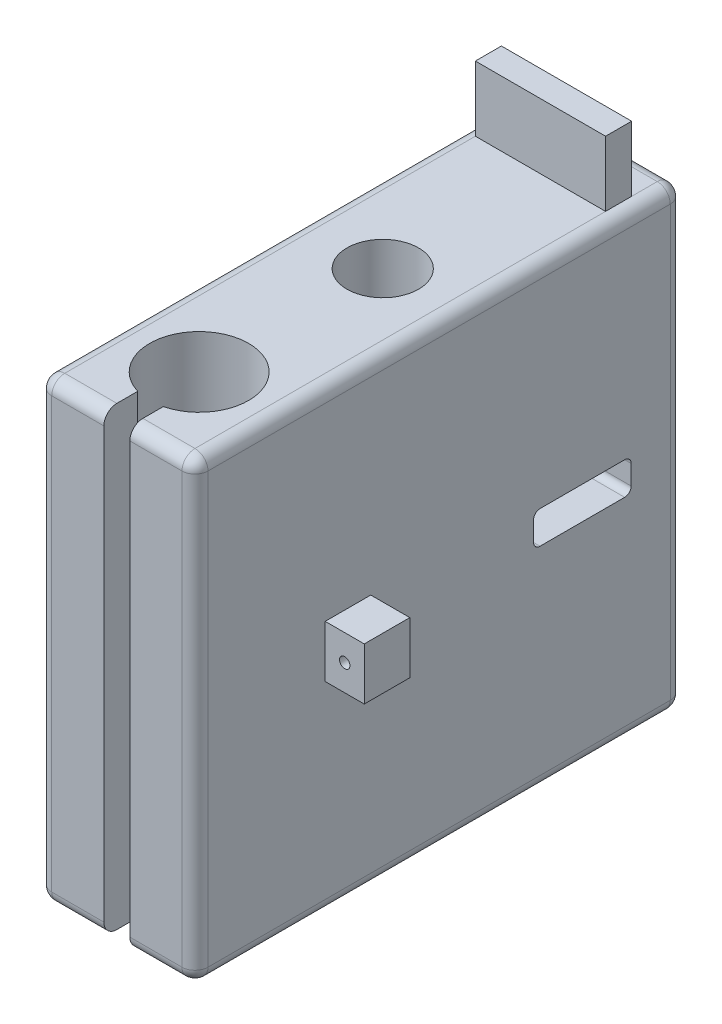
from build123d import *

# Parameters (mm, degrees)
RESSALTO_EXTRUS_O1_DEPTH                   = 12
RESSALTO_EXTRUS_O1_DEPTH_BACK              = 12
ESBO_O1_W                                  = 75
ESBO_O1_H                                  = 70
ESBO_O3_R                                  = 5.5
CORTE_EXTRUS_O1_DEPTH                      = 525.799189678
ESBO_O4_R                                  = 4.1
CORTE_EXTRUS_O2_DEPTH                      = 20
FILETE1_R                                  = 2
CORTE_EXTRUS_O3_DEPTH                      = 29
CORTE_EXTRUS_O4_DEPTH                      = 28
RESSALTO_EXTRUS_O2_DEPTH                   = 6
RESSALTO_EXTRUS_O2_DEPTH_BACK              = 30
ESBO_O7_W                                  = 7
ESBO_O7_H                                  = 8
BROCA_DE_ROSQUEAR_PARA_TARRAXA_DE_M2X0_4_D = 1.6
BROCA_DE_ROSQUEAR_PARA_TARRAXA_DE_M2_2_D   = 1.6
ESBO_O18_W                                 = 20
ESBO_O18_H                                 = 4
RESSALTO_EXTRUS_O3_DEPTH                   = 10


with BuildPart() as part:
    # Esboço1 → Ressalto-extrusão1 (new, two sides: drawn at the far end of the back side and taken through both)
    with BuildSketch(Plane(origin=(-220, 0, 0), x_dir=(0, 0, -1), z_dir=(1, 0, 0)).offset(-RESSALTO_EXTRUS_O1_DEPTH_BACK)):
        with Locations((-427.999935002, 213.253952806)):
            Rectangle(ESBO_O1_W, ESBO_O1_H)
    extrude(amount=RESSALTO_EXTRUS_O1_DEPTH + RESSALTO_EXTRUS_O1_DEPTH_BACK)

    # Esboço3 → Corte-extrusão1 (cut, through all)
    with BuildSketch(Plane(origin=(0, 248.253952806, 0), x_dir=(1, 0, 0), z_dir=(0, 1, 0))):
        with Locations((-219.508549322, -425.149935105)):
            Circle(ESBO_O3_R)
        with BuildLine():
            Line((-220, -465.499935002), (-218, -465.499935002))
            Line((-218, -465.499935002), (-218, -460.369179456))
            ThreePointArc((-218, -460.369179456), (-219.711945476, -445.401349285), (-222, -460.292000844))
            Line((-222, -460.292000844), (-222, -465.499935002))
            Line((-222, -465.499935002), (-220, -465.499935002))
        make_face()
    extrude(amount=-CORTE_EXTRUS_O1_DEPTH, mode=Mode.SUBTRACT)

    # Esboço4 → Corte-extrusão2 (cut)
    with BuildSketch(Plane(origin=(0, 0, 390.499935002), x_dir=(-1, 0, 0), z_dir=(0, 0, -1))):
        with Locations((219.858557552, 238.253952806)):
            Circle(ESBO_O4_R)
        with Locations((219.858557552, 188.253952806)):
            Circle(ESBO_O4_R)
    extrude(amount=-CORTE_EXTRUS_O2_DEPTH, mode=Mode.SUBTRACT)

    # Filete1
    filete1_edges = [part.edges().sort_by_distance(p)[0] for p in [
        (-227, 178.253952806, 465.499935002),
        (-213, 178.253952806, 465.499935002),
        (-213, 248.253952806, 465.499935002),
        (-227, 248.253952806, 465.499935002),
        (-208, 178.253952806, 427.999935002),
        (-208, 248.253952806, 427.999935002),
        (-208, 213.253952806, 465.499935002),
        (-232, 178.253952806, 427.999935002),
        (-232, 213.253952806, 465.499935002),
        (-232, 248.253952806, 427.999935002),
        (-220, 248.253952806, 390.499935002),
        (-220, 178.253952806, 390.499935002),
        (-208, 213.253952806, 390.499935002),
        (-232, 213.253952806, 390.499935002),
    ]]
    fillet(filete1_edges, radius=FILETE1_R)

    # Esboço5 → Corte-extrusão3 (cut)
    with BuildSketch(Plane(origin=(0, 0, 390.499935002), x_dir=(-1, 0, 0), z_dir=(0, 0, -1))):
        Polygon((214.016351673, 195.258511774), (226.016347643, 195.248677568), (226.045850263, 231.248665479), (214.045854293, 231.258499685), align=None)
    extrude(amount=-CORTE_EXTRUS_O3_DEPTH, mode=Mode.SUBTRACT)

    # Esboço6 → Corte-extrusão4 (cut)
    with BuildSketch(Plane.ZY.offset(232)):
        with BuildLine():
            Line((399.499935002, 215.753952806), (412.499935002, 215.753952806))
            ThreePointArc((412.499935002, 215.753952806), (413.207041783, 215.461059587), (413.499935002, 214.753952806))
            Line((413.499935002, 214.753952806), (413.499935002, 211.753952806))
            ThreePointArc((413.499935002, 211.753952806), (413.207041783, 211.046846025), (412.499935002, 210.753952806))
            Line((412.499935002, 210.753952806), (399.499935002, 210.753952806))
            ThreePointArc((399.499935002, 210.753952806), (398.792828221, 211.046846025), (398.499935002, 211.753952806))
            Line((398.499935002, 211.753952806), (398.499935002, 214.753952806))
            ThreePointArc((398.499935002, 214.753952806), (398.792828221, 215.461059587), (399.499935002, 215.753952806))
        make_face()
    extrude(amount=-CORTE_EXTRUS_O4_DEPTH, mode=Mode.SUBTRACT)

    # Esboço7 → Ressalto-extrusão2 (add, two sides: drawn at the far end of the back side and taken through both)
    with BuildSketch(Plane(origin=(-208, 0, 0), x_dir=(0, 0, -1), z_dir=(1, 0, 0)).offset(-RESSALTO_EXTRUS_O2_DEPTH_BACK)):
        with Locations((-441.999935002, 213.253952806)):
            Rectangle(ESBO_O7_W, ESBO_O7_H)
    extrude(amount=RESSALTO_EXTRUS_O2_DEPTH + RESSALTO_EXTRUS_O2_DEPTH_BACK)

    # Broca de rosquear para tarraxa de M2x0.4 (through all)
    with Locations(Plane.XY.offset(445.499935002)):
        with Locations((-205, 213.253952806)):
            Hole(BROCA_DE_ROSQUEAR_PARA_TARRAXA_DE_M2X0_4_D / 2)

    # Broca de rosquear para tarraxa de M2 2 (through all)
    with Locations(Plane.XY.offset(445.499935002)):
        with Locations((-235, 213.253952806)):
            Hole(BROCA_DE_ROSQUEAR_PARA_TARRAXA_DE_M2_2_D / 2)

    # Esboço18 → Ressalto-extrusão3 (add)
    with BuildSketch(Plane(origin=(0, 248.253952806, 0), x_dir=(1, 0, 0), z_dir=(0, 1, 0))):
        with Locations((-220, -398.434558943)):
            Rectangle(ESBO_O18_W, ESBO_O18_H)
    extrude(amount=RESSALTO_EXTRUS_O3_DEPTH)


solid = part.part
